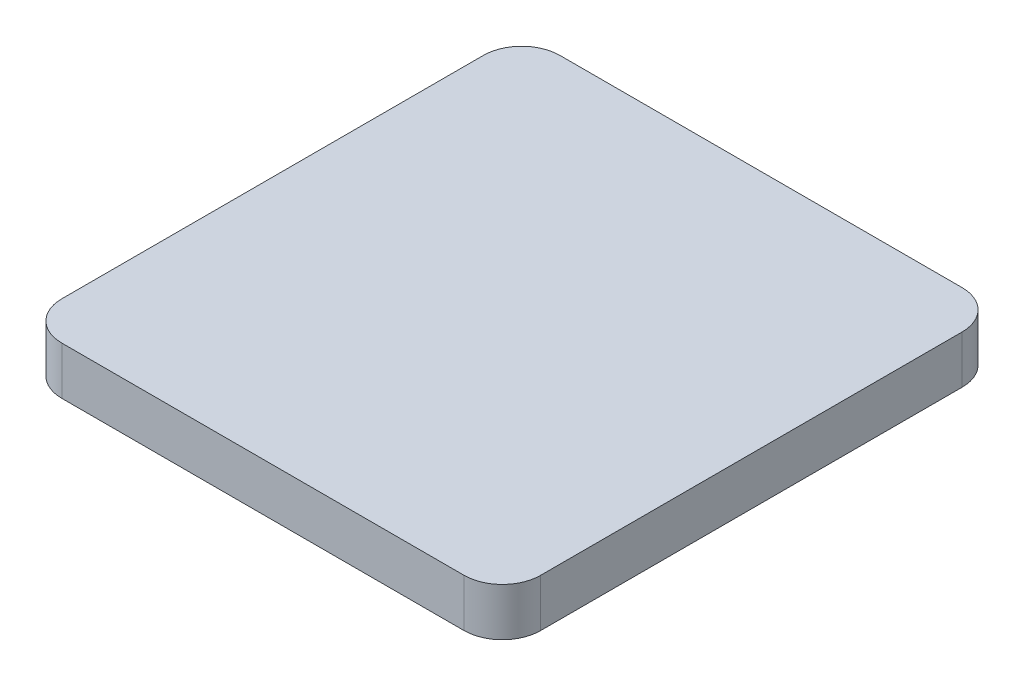
from build123d import *

# Parameters (mm, degrees)
SKETCH1_W           = 31.75
SKETCH1_H           = 33.03
BOSS_EXTRUDE1_DEPTH = 3.175
FILLET1_R           = 2.54


with BuildPart() as part:
    # Sketch1 → Boss-Extrude1 (new body)
    with BuildSketch(Plane(origin=(0, 0, 0), x_dir=(1, 0, 0), z_dir=(0, 1, 0))):
        with Locations((15.875, 16.515)):
            Rectangle(SKETCH1_W, SKETCH1_H)
    extrude(amount=BOSS_EXTRUDE1_DEPTH)

    # Fillet1
    fillet1_edges = [part.edges().sort_by_distance(p)[0] for p in [
        (0, 1.5875, -33.03),
        (31.75, 1.5875, -33.03),
        (31.75, 1.5875, 0),
        (0, 1.5875, 0),
    ]]
    fillet(fillet1_edges, radius=FILLET1_R)


solid = part.part
